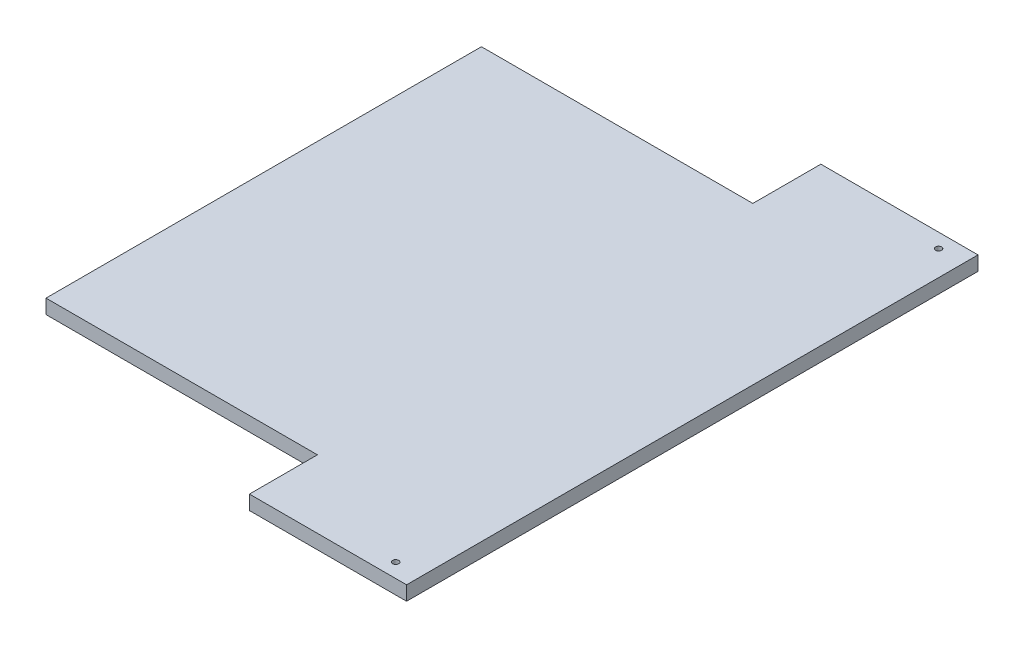
from build123d import *

# Parameters (mm, degrees)
SKETCH1_W           = 381
SKETCH1_H           = 508
BOSS_EXTRUDE1_DEPTH = 6.35
SKETCH2_W           = 241.3
SKETCH2_H           = 60.452
CUT_EXTRUDE1_DEPTH  = 230.886
SKETCH3_R           = 2.667
CUT_EXTRUDE2_DEPTH  = 230.886


with BuildPart() as part:
    # Sketch1 → Boss-Extrude1 (new, symmetric)
    with BuildSketch(Plane(origin=(0, 0, 0), x_dir=(1, 0, 0), z_dir=(0, 1, 0))):
        Rectangle(SKETCH1_W, SKETCH1_H)
    extrude(amount=BOSS_EXTRUDE1_DEPTH, both=True)

    # Sketch2 → Cut-Extrude1 (cut)
    with BuildSketch(Plane(origin=(0, 6.35, 0), x_dir=(1, 0, 0), z_dir=(0, 1, 0))):
        with Locations((-69.85, -223.774)):
            Rectangle(SKETCH2_W, SKETCH2_H)
        with Locations((-69.85, 223.774)):
            Rectangle(SKETCH2_W, SKETCH2_H)
    extrude(amount=-CUT_EXTRUDE1_DEPTH, mode=Mode.SUBTRACT)

    # Sketch3 → Cut-Extrude2 (cut)
    with BuildSketch(Plane(origin=(0, 6.35, 0), x_dir=(1, 0, 0), z_dir=(0, 1, 0))):
        with Locations((168.148, -241.3)):
            Circle(SKETCH3_R)
        with Locations((168.148, 241.3)):
            Circle(SKETCH3_R)
    extrude(amount=-CUT_EXTRUDE2_DEPTH, mode=Mode.SUBTRACT)


solid = part.part
